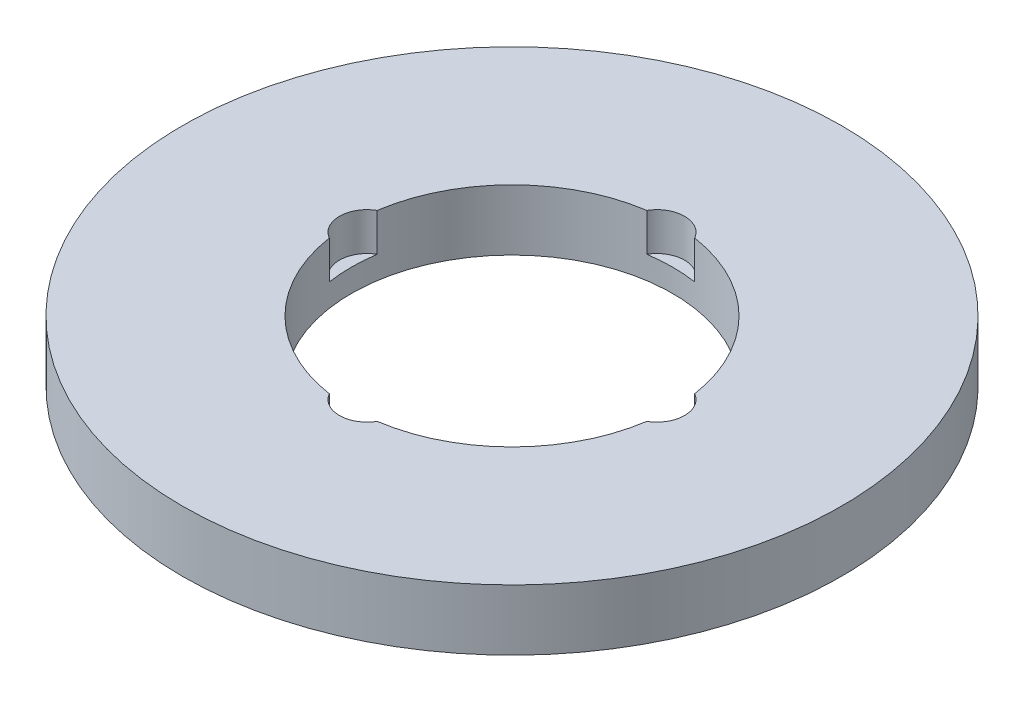
from build123d import *

# Parameters (mm, degrees)
SKETCH1_R           = 97.5
BOSS_EXTRUDE1_DEPTH = 18
SKETCH2_R           = 47.5
CUT_EXTRUDE1_DEPTH  = 140.055744218
SKETCH3_R           = 8.179980897
CUT_EXTRUDE2_DEPTH  = 11.247404448
CIRPATTERN1_COUNT   = 4


with BuildPart() as part:
    # Sketch1 → Boss-Extrude1 (new body)
    with BuildSketch(Plane(origin=(0, 0, 0), x_dir=(1, 0, 0), z_dir=(0, 1, 0))):
        Circle(SKETCH1_R)
    extrude(amount=BOSS_EXTRUDE1_DEPTH)

    # Sketch2 → Cut-Extrude1 (cut, through all)
    with BuildSketch(Plane(origin=(0, 0, 0), x_dir=(1, 0, 0), z_dir=(0, 1, 0))):
        Circle(SKETCH2_R)
    extrude(amount=CUT_EXTRUDE1_DEPTH, mode=Mode.SUBTRACT)

    # Sketch3 → Cut-Extrude2 (cut)
    with BuildSketch(Plane(origin=(0, 18, 0), x_dir=(1, 0, 0), z_dir=(0, 1, 0))):
        with Locations((-42.875106752, 0)):
            Circle(SKETCH3_R)
    cut_extrude2 = extrude(amount=-CUT_EXTRUDE2_DEPTH, mode=Mode.SUBTRACT)

    # CirPattern1: Cut-Extrude2 ×4 about axis
    cirpattern1_axis = Axis((0, 0, 0), (0, 1, 0))
    for i in range(1, CIRPATTERN1_COUNT):
        add(cut_extrude2.rotate(cirpattern1_axis, i * 360 / CIRPATTERN1_COUNT), mode=Mode.SUBTRACT)


solid = part.part
